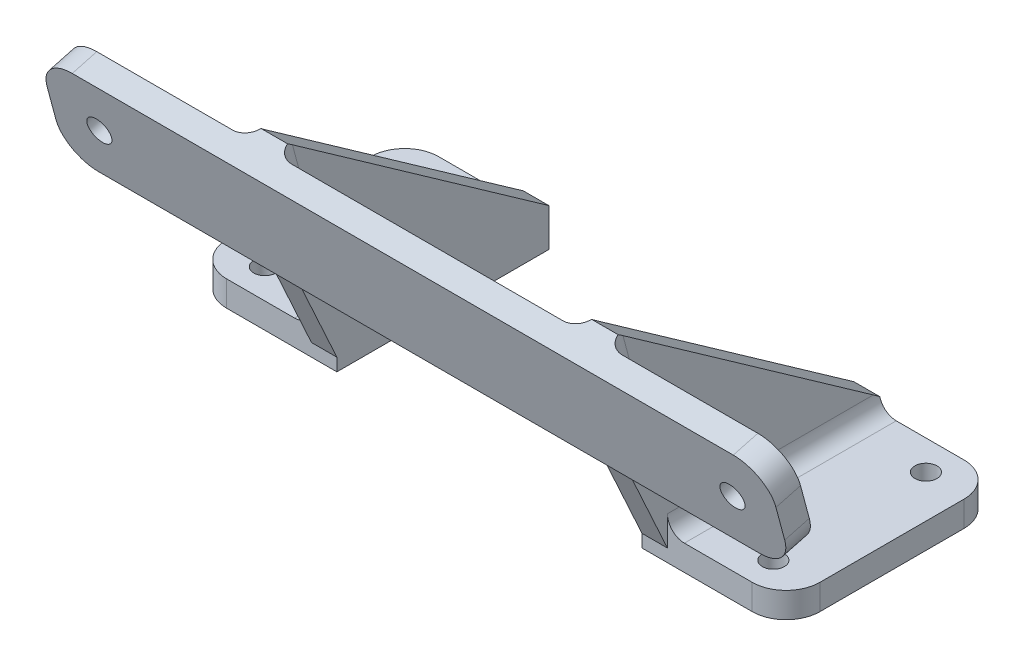
from build123d import *

# Parameters (mm, degrees)
SKETCH1_W             = 17
SKETCH1_H             = 25
BOSS_EXTRUDE1_DEPTH   = 3
BOSS_EXTRUDE1_2_DEPTH = 3
SKETCH2_W             = 86
SKETCH2_H             = 12
BOSS_EXTRUDE2_DEPTH   = 3
SKETCH3_R             = 1.3
CUT_EXTRUDE1_DEPTH    = 3
SKETCH4_R             = 1.44
CUT_EXTRUDE2_DEPTH    = 3
BOSS_EXTRUDE3_START   = 18
BOSS_EXTRUDE3_DEPTH   = 3
BOSS_EXTRUDE4_START   = -18
BOSS_EXTRUDE4_DEPTH   = 3
FILLET1_R             = 2
FILLET2_R             = 4


with BuildPart() as part:
    # Sketch1 → Boss-Extrude1 (new body)
    with BuildSketch(Plane(origin=(0, 0, 0), x_dir=(1, 0, 0), z_dir=(0, 1, 0))):
        with Locations((-26.5, 16)):
            Rectangle(SKETCH1_W, SKETCH1_H)
    extrude(amount=BOSS_EXTRUDE1_DEPTH)


with BuildPart() as body_2:
    # Sketch1 → Boss-Extrude1 2 (new body)
    with BuildSketch(Plane(origin=(0, 0, 0), x_dir=(1, 0, 0), z_dir=(0, 1, 0))):
        with Locations((26.5, 16)):
            Rectangle(SKETCH1_W, SKETCH1_H)
    extrude(amount=BOSS_EXTRUDE1_2_DEPTH)


with BuildPart() as body_3:
    # Sketch2 → Boss-Extrude2 (new body)
    with BuildSketch(Plane(origin=(0, 0, 0), x_dir=(1, 0, 0), z_dir=(0, 0.2588190451025247, -0.9659258262890672))):
        with Locations((0, -20)):
            Rectangle(SKETCH2_W, SKETCH2_H)
    extrude(amount=BOSS_EXTRUDE2_DEPTH)

    # Sketch4 → Cut-Extrude2 (cut)
    with BuildSketch(Plane(origin=(0, 0, 0), x_dir=(1, 0, 0), z_dir=(0, -0.25881904510252474, 0.9659258262890673))):
        with Locations(Location((-37.35, 20, 0), (0, 0, 270))):
            Circle(SKETCH4_R)
        with Locations(Location((37.35, 20, 0), (0, 0, 270))):
            Circle(SKETCH4_R)
    extrude(amount=-CUT_EXTRUDE2_DEPTH, mode=Mode.SUBTRACT)


with BuildPart() as cut_extrude1_tool:
    # Sketch3 → Cut-Extrude1 (new body)
    with BuildSketch(Plane.XZ):
        with Locations(Location((30, -25, 0), (0, 0, 270))):
            Circle(SKETCH3_R)
        with Locations(Location((30, -7, 0), (0, 0, 270))):
            Circle(SKETCH3_R)
        with Locations(Location((-30, -25, 0), (0, 0, 270))):
            Circle(SKETCH3_R)
        with Locations(Location((-30, -7, 0), (0, 0, 270))):
            Circle(SKETCH3_R)
    extrude(amount=-CUT_EXTRUDE1_DEPTH)


with BuildPart() as part_1:
    add(part.part)

    # Cut-Extrude1: cut by cut_extrude1_tool
    add(cut_extrude1_tool.part, mode=Mode.SUBTRACT)



with BuildPart() as body_2_1:
    add(body_2.part)

    # Cut-Extrude1: cut by cut_extrude1_tool
    add(cut_extrude1_tool.part, mode=Mode.SUBTRACT)


    add(body_3.part)  # Boss-Extrude3 merges body 3
    # Sketch5 → Boss-Extrude3 (add)
    with BuildSketch(Plane(origin=(0, 0, 0), x_dir=(0, 0, -1), z_dir=(1, 0, 0)).offset(BOSS_EXTRUDE3_START)):
        Polygon((3.5, 3), (28.5, 3), (28.5, 4.5), (-2.382628954, 26.278757186), (-3.831517694, 25.890528619), (-0.725689153, 14.299418703), (-2.174577892, 13.911190136), (3.5, 1.5), align=None)
    extrude(amount=BOSS_EXTRUDE3_DEPTH)


with BuildPart() as part_2:
    add(part_1.part)

    add(body_2_1.part)  # Boss-Extrude4 merges body 2
    # Sketch5<2> → Boss-Extrude4 (add)
    with BuildSketch(Plane(origin=(0, 0, 0), x_dir=(0, 0, -1), z_dir=(1, 0, 0)).offset(BOSS_EXTRUDE4_START)):
        Polygon((3.5, 3), (28.5, 3), (28.5, 4.5), (-2.382628954, 26.278757186), (-3.831517694, 25.890528619), (-0.725689153, 14.299418703), (-2.174577892, 13.911190136), (3.5, 1.5), align=None)
    extrude(amount=-BOSS_EXTRUDE4_DEPTH)

    # Fillet1
    # the kernel refuses this fillet: 2 mm, written as the material it adds along each edge
    with BuildSketch(Plane(origin=(-21, 3, -3.5), x_dir=(0, 1, 0), z_dir=(0, 0, -1))) as fillet1_piece_1_section:
        with BuildLine():
            CenterArc((FILLET1_R, -FILLET1_R), FILLET1_R, 90, 90)
            Line((0, -FILLET1_R), (0, 0))
            Line((0, 0), (FILLET1_R, 0))
        make_face()
    fillet1_piece_1 = extrude(amount=25, mode=Mode.PRIVATE)
    fillet1_piece_1 = split(fillet1_piece_1, bisect_by=Plane(origin=(-21.452953813, 10.041317551, -20.642322338), z_dir=(0, -0.8172264215847361, 0.5763167322434836)), keep=Keep.TOP, mode=Mode.PRIVATE)
    add(fillet1_piece_1)
    with BuildSketch(Plane(origin=(21, 3, -3.5), x_dir=(0, 1, 0), z_dir=(0, 0, -1))) as fillet1_piece_2_section:
        with BuildLine():
            CenterArc((FILLET1_R, FILLET1_R), FILLET1_R, 180, 90)
            Line((0, FILLET1_R), (0, 0))
            Line((0, 0), (FILLET1_R, 0))
        make_face()
    fillet1_piece_2 = extrude(amount=25, mode=Mode.PRIVATE)
    fillet1_piece_2 = split(fillet1_piece_2, bisect_by=Plane(origin=(21.452953813, 10.041317551, -20.642322338), z_dir=(0, -0.8172264215847361, 0.5763167322434836)), keep=Keep.TOP, mode=Mode.PRIVATE)
    add(fillet1_piece_2)
    with BuildSketch(Plane(origin=(-18, 25.890528619, 3.831517694), x_dir=(1, 0, 0), z_dir=(0, -0.9659258262890673, -0.2588190451025247))) as fillet1_piece_3_section:
        with BuildLine():
            CenterArc((FILLET1_R, -FILLET1_R), FILLET1_R, 90, 90)
            Line((0, -FILLET1_R), (0, 0))
            Line((0, 0), (FILLET1_R, 0))
        make_face()
    fillet1_piece_3 = extrude(amount=12, mode=Mode.PRIVATE)
    fillet1_piece_3 = split(fillet1_piece_3, bisect_by=Plane(origin=(-17.546921316, 24.007524822, -0.83801517), z_dir=(0, -0.8172264215847361, 0.5763167322434836)), keep=Keep.TOP, mode=Mode.PRIVATE)
    add(fillet1_piece_3)
    with BuildSketch(Plane(origin=(-21, 25.890528619, 3.831517694), x_dir=(0, 0.2588190451025247, -0.9659258262890672), z_dir=(0, -0.9659258262890673, -0.2588190451025247))) as fillet1_piece_4_section:
        with BuildLine():
            CenterArc((FILLET1_R, -FILLET1_R), FILLET1_R, 90, 90)
            Line((0, -FILLET1_R), (0, 0))
            Line((0, 0), (FILLET1_R, 0))
        make_face()
    fillet1_piece_4 = extrude(amount=12, mode=Mode.PRIVATE)
    fillet1_piece_4 = split(fillet1_piece_4, bisect_by=Plane(origin=(-21.453078684, 24.007524822, -0.838015171), z_dir=(0, -0.8172264215847361, 0.5763167322434836)), keep=Keep.TOP, mode=Mode.PRIVATE)
    add(fillet1_piece_4)
    with BuildSketch(Plane(origin=(21, 25.890528619, 3.831517694), x_dir=(1, 0, 0), z_dir=(0, -0.9659258262890673, -0.2588190451025247))) as fillet1_piece_5_section:
        with BuildLine():
            CenterArc((FILLET1_R, -FILLET1_R), FILLET1_R, 90, 90)
            Line((0, -FILLET1_R), (0, 0))
            Line((0, 0), (FILLET1_R, 0))
        make_face()
    fillet1_piece_5 = extrude(amount=12, mode=Mode.PRIVATE)
    fillet1_piece_5 = split(fillet1_piece_5, bisect_by=Plane(origin=(21.453078684, 24.007524822, -0.83801517), z_dir=(0, -0.8172264215847361, 0.5763167322434836)), keep=Keep.TOP, mode=Mode.PRIVATE)
    add(fillet1_piece_5)
    with BuildSketch(Plane(origin=(18, 25.890528619, 3.831517694), x_dir=(-1.776356839400251e-15, 0.25881904510252474, -0.9659258262890673), z_dir=(0, -0.9659258262890673, -0.2588190451025247))) as fillet1_piece_6_section:
        with BuildLine():
            CenterArc((FILLET1_R, -FILLET1_R), FILLET1_R, 90, 90)
            Line((0, -FILLET1_R), (0, 0))
            Line((0, 0), (FILLET1_R, 0))
        make_face()
    fillet1_piece_6 = extrude(amount=12, mode=Mode.PRIVATE)
    fillet1_piece_6 = split(fillet1_piece_6, bisect_by=Plane(origin=(17.546921316, 24.007524822, -0.838015171), z_dir=(0, -0.8172264215847361, 0.5763167322434836)), keep=Keep.TOP, mode=Mode.PRIVATE)
    add(fillet1_piece_6)

    # Fillet2
    fillet2_edges = [part_2.edges().sort_by_distance(p)[0] for p in [
        (43, 13.911190136, 2.174577892),
        (-43, 13.911190136, 2.174577892),
        (-43, 25.502300051, 5.280406433),
        (43, 25.502300051, 5.280406433),
        (35, 1.5, -28.5),
        (35, 1.5, -3.5),
        (-35, 1.5, -28.5),
        (-35, 1.5, -3.5),
    ]]
    fillet(fillet2_edges, radius=FILLET2_R)


solid = part_2.part
